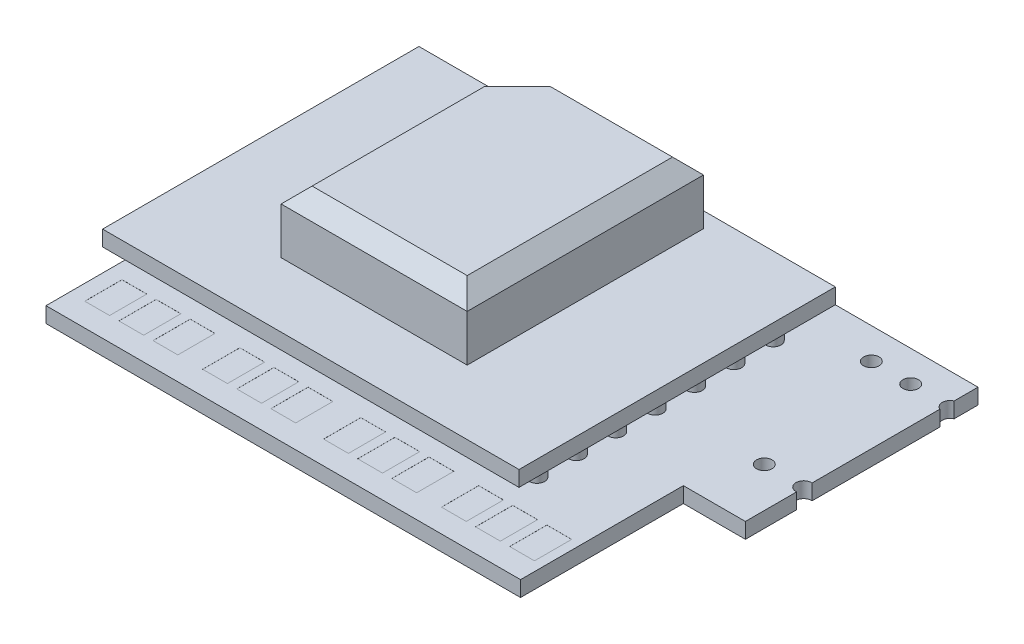
from build123d import *

# Parameters (mm, degrees)
BOSS_EXTRUDE1_DEPTH = 1
SKETCH2_R           = 0.5
CUT_EXTRUDE1_DEPTH  = 1
SKETCH3_W           = 1.6
SKETCH3_H           = 2.4
CUT_EXTRUDE2_DEPTH  = 0.005
SKETCH4_W           = 1.034148057
SKETCH4_H           = 1.598228816
CUT_EXTRUDE3_DEPTH  = 0.5
MIRROR1_START       = -10.144020373
MIRROR1_OUTLINE_W   = 1.034148057
MIRROR1_OUTLINE_H   = 0.5
MIRROR1_DEPTH       = 1.598228816
MIRROR1_START_2     = -5.06025641
MIRROR1_2_OUTLINE_W = 1.6
MIRROR1_2_OUTLINE_H = 0.005
MIRROR1_2_DEPTH     = 2.4
SKETCH5_W           = 1.034148057
SKETCH5_H           = 1
BOSS_EXTRUDE2_DEPTH = 5
SKETCH6_W           = 1.6
SKETCH6_H           = 2.4
CUT_EXTRUDE9_DEPTH  = 2
SKETCH7_W           = 1.6
SKETCH7_H           = 2.4
BOSS_EXTRUDE3_DEPTH = 0.9
SKETCH8_W           = 1.639105769
SKETCH8_H           = 2.261242675
CUT_EXTRUDE10_DEPTH = 0.5
MIRROR2_START       = 0.905
MIRROR2_OUTLINE_W   = 1.6
MIRROR2_OUTLINE_H   = 2.4
MIRROR2_DEPTH       = 0.09
SKETCH9_W           = 1.6
SKETCH9_H           = 2.4
CUT_EXTRUDE11_DEPTH = 0.1
SKETCH11_W          = 1.639105769
SKETCH11_H          = 2.261242675
BOSS_EXTRUDE4_DEPTH = 0.5
SKETCH12_R          = 0.5
BOSS_EXTRUDE5_DEPTH = 3
SKETCH13_W          = 24
SKETCH13_H          = 17.24
BOSS_EXTRUDE6_DEPTH = 1
SKETCH14_W          = 12
SKETCH14_H          = 15.24
BOSS_EXTRUDE7_DEPTH = 4
CUT_EXTRUDE12_DEPTH = 4
CHAMFER1_SIZE       = 1
BOSS_EXTRUDE8_DEPTH = 1
CUT_EXTRUDE13_DEPTH = 10


# Read off the part's stored shape, not the designer's step: Mirror1, Mirror2
with BuildPart() as part:
    # Sketch1 → Boss-Extrude1 (new body)
    with BuildSketch(Plane(origin=(0, 0, 0), x_dir=(1, 0, 0), z_dir=(0, 1, 0))):
        Polygon((-37.923076923, 26.66025641), (13.076923077, 26.66025641), (13.076923077, 11.66025641), (2.876923077, 11.66025641), (2.876923077, 1.16025641), (-27.723076923, 1.16025641), (-27.723076923, 11.66025641), (-37.923076923, 11.66025641), align=None)
    extrude(amount=BOSS_EXTRUDE1_DEPTH)

    # Sketch2 → Cut-Extrude1 (cut)
    with BuildSketch(Plane(origin=(0, 1, 0), x_dir=(1, 0, 0), z_dir=(0, 1, 0))):
        with Locations(Location((-33.923076923, 22.16025641, 0), (0, 0, 270))):
            Circle(SKETCH2_R)
        with Locations(Location((-33.923076923, 19.62025641, 0), (0, 0, 270))):
            Circle(SKETCH2_R)
        with Locations(Location((9.826923077, 22.41025641, 0), (0, 0, 270))):
            Circle(SKETCH2_R)
        with Locations(Location((9.826923077, 19.87025641, 0), (0, 0, 270))):
            Circle(SKETCH2_R)
        with Locations(Location((-35.123076923, 15.06025641, 0), (0, 0, 270))):
            Circle(SKETCH2_R)
        with Locations(Location((-32.583076923, 15.06025641, 0), (0, 0, 270))):
            Circle(SKETCH2_R)
        with Locations(Location((-30.043076923, 15.06025641, 0), (0, 0, 270))):
            Circle(SKETCH2_R)
        with Locations(Location((9.376923077, 15.46025641, 0), (0, 0, 270))):
            Circle(SKETCH2_R)
        with Locations(Location((6.836923077, 15.46025641, 0), (0, 0, 270))):
            Circle(SKETCH2_R)
        with Locations(Location((4.296923077, 15.46025641, 0), (0, 0, 270))):
            Circle(SKETCH2_R)
        with Locations(Location((7.076923077, 24.66025641, 0), (0, 0, 270))):
            Circle(SKETCH2_R)
        with Locations(Location((4.536923077, 24.66025641, 0), (0, 0, 270))):
            Circle(SKETCH2_R)
        with Locations(Location((1.996923077, 24.66025641, 0), (0, 0, 270))):
            Circle(SKETCH2_R)
    extrude(amount=-CUT_EXTRUDE1_DEPTH, mode=Mode.SUBTRACT)

    # Sketch3 → Cut-Extrude2 (cut)
    with BuildSketch(Plane(origin=(0, 1, 0), x_dir=(1, 0, 0), z_dir=(0, 1, 0))):
        with Locations((-25.923076923, 3.86025641)):
            Rectangle(SKETCH3_W, SKETCH3_H)
        with Locations((-23.723076923, 3.86025641)):
            Rectangle(SKETCH3_W, SKETCH3_H)
        with Locations((-21.523076923, 3.86025641)):
            Rectangle(SKETCH3_W, SKETCH3_H)
        with Locations((-18.323076923, 3.86025641)):
            Rectangle(SKETCH3_W, SKETCH3_H)
        with Locations((-16.123076923, 3.86025641)):
            Rectangle(SKETCH3_W, SKETCH3_H)
        with Locations((-13.923076923, 3.86025641)):
            Rectangle(SKETCH3_W, SKETCH3_H)
        with Locations((-10.523076923, 3.86025641)):
            Rectangle(SKETCH3_W, SKETCH3_H)
        with Locations((-8.323076923, 3.86025641)):
            Rectangle(SKETCH3_W, SKETCH3_H)
        with Locations((-6.123076923, 3.86025641)):
            Rectangle(SKETCH3_W, SKETCH3_H)
        with Locations((-2.923076923, 3.86025641)):
            Rectangle(SKETCH3_W, SKETCH3_H)
        with Locations((-0.723076923, 3.86025641)):
            Rectangle(SKETCH3_W, SKETCH3_H)
        with Locations((1.476923077, 3.86025641)):
            Rectangle(SKETCH3_W, SKETCH3_H)
    extrude(amount=-CUT_EXTRUDE2_DEPTH, mode=Mode.SUBTRACT)

    # Sketch4 → Cut-Extrude3 (cut)
    with BuildSketch(Plane(origin=(0, 1, 0), x_dir=(1, 0, 0), z_dir=(0, 1, 0))):
        with Locations((-12.189708408, 9.344905965)):
            Rectangle(SKETCH4_W, SKETCH4_H)
    extrude(amount=-CUT_EXTRUDE3_DEPTH, mode=Mode.SUBTRACT)

    # Mirror1 outline → Mirror1 (cut)
    with BuildSketch(Plane.XY.offset(MIRROR1_START)):
        with Locations((-12.189708408, 0.25)):
            Rectangle(MIRROR1_OUTLINE_W, MIRROR1_OUTLINE_H)
    extrude(amount=MIRROR1_DEPTH, mode=Mode.SUBTRACT)

    # Mirror1 2 outline → Mirror1 2 (cut)
    with BuildSketch(Plane.XY.offset(MIRROR1_START_2)):
        with Locations((1.476923077, 0.0025)):
            Rectangle(MIRROR1_2_OUTLINE_W, MIRROR1_2_OUTLINE_H)
        with Locations((-0.723076923, 0.0025)):
            Rectangle(MIRROR1_2_OUTLINE_W, MIRROR1_2_OUTLINE_H)
        with Locations((-2.923076923, 0.0025)):
            Rectangle(MIRROR1_2_OUTLINE_W, MIRROR1_2_OUTLINE_H)
        with Locations((-6.123076923, 0.0025)):
            Rectangle(MIRROR1_2_OUTLINE_W, MIRROR1_2_OUTLINE_H)
        with Locations((-8.323076923, 0.0025)):
            Rectangle(MIRROR1_2_OUTLINE_W, MIRROR1_2_OUTLINE_H)
        with Locations((-10.523076923, 0.0025)):
            Rectangle(MIRROR1_2_OUTLINE_W, MIRROR1_2_OUTLINE_H)
        with Locations((-13.923076923, 0.0025)):
            Rectangle(MIRROR1_2_OUTLINE_W, MIRROR1_2_OUTLINE_H)
        with Locations((-16.123076923, 0.0025)):
            Rectangle(MIRROR1_2_OUTLINE_W, MIRROR1_2_OUTLINE_H)
        with Locations((-18.323076923, 0.0025)):
            Rectangle(MIRROR1_2_OUTLINE_W, MIRROR1_2_OUTLINE_H)
        with Locations((-21.523076923, 0.0025)):
            Rectangle(MIRROR1_2_OUTLINE_W, MIRROR1_2_OUTLINE_H)
        with Locations((-23.723076923, 0.0025)):
            Rectangle(MIRROR1_2_OUTLINE_W, MIRROR1_2_OUTLINE_H)
        with Locations((-25.923076923, 0.0025)):
            Rectangle(MIRROR1_2_OUTLINE_W, MIRROR1_2_OUTLINE_H)
    extrude(amount=MIRROR1_2_DEPTH, mode=Mode.SUBTRACT)

    # Sketch5 → Boss-Extrude2 (add)
    with BuildSketch(Plane.XY.offset(-10.144020373)):
        with Locations((-12.189708408, 0.5)):
            Rectangle(SKETCH5_W, SKETCH5_H)
    extrude(amount=BOSS_EXTRUDE2_DEPTH)

    # Sketch6 → Cut-Extrude9 (cut)
    with BuildSketch(Plane(origin=(0, 0.005, 0), x_dir=(-1, 0, 0), z_dir=(0, -1, 0))):
        with Locations((17.523076923, 24.677244948)):
            Rectangle(SKETCH6_W, SKETCH6_H)
        with Locations((15.323076923, 24.677244948)):
            Rectangle(SKETCH6_W, SKETCH6_H)
        with Locations((13.123076923, 24.677244948)):
            Rectangle(SKETCH6_W, SKETCH6_H)
        with Locations((10.923076923, 24.677244948)):
            Rectangle(SKETCH6_W, SKETCH6_H)
        with Locations((8.723076923, 24.677244948)):
            Rectangle(SKETCH6_W, SKETCH6_H)
        with Locations((6.523076923, 24.677244948)):
            Rectangle(SKETCH6_W, SKETCH6_H)
        with Locations((17.523076923, 18.037244948)):
            Rectangle(SKETCH6_W, SKETCH6_H)
        with Locations((15.323076923, 18.037244948)):
            Rectangle(SKETCH6_W, SKETCH6_H)
        with Locations((13.123076923, 18.037244948)):
            Rectangle(SKETCH6_W, SKETCH6_H)
        with Locations((10.923076923, 18.037244948)):
            Rectangle(SKETCH6_W, SKETCH6_H)
        with Locations((8.723076923, 18.037244948)):
            Rectangle(SKETCH6_W, SKETCH6_H)
        with Locations((6.523076923, 18.037244948)):
            Rectangle(SKETCH6_W, SKETCH6_H)
        with Locations((18.163076923, 12.637244948)):
            Rectangle(SKETCH6_W, SKETCH6_H)
        with Locations((15.963076923, 12.637244948)):
            Rectangle(SKETCH6_W, SKETCH6_H)
        with Locations((13.763076923, 12.637244948)):
            Rectangle(SKETCH6_W, SKETCH6_H)
        with Locations((11.563076923, 12.637244948)):
            Rectangle(SKETCH6_W, SKETCH6_H)
        with Locations((9.363076923, 12.637244948)):
            Rectangle(SKETCH6_W, SKETCH6_H)
        with Locations((7.163076923, 12.637244948)):
            Rectangle(SKETCH6_W, SKETCH6_H)
    extrude(amount=-CUT_EXTRUDE9_DEPTH, mode=Mode.SUBTRACT)

    # Sketch7 → Boss-Extrude3 (add)
    with BuildSketch(Plane(origin=(0, 0.005, 0), x_dir=(1, 0, 0), z_dir=(0, 1, 0))):
        with Locations((-17.523076923, 24.677244948)):
            Rectangle(SKETCH7_W, SKETCH7_H)
        with Locations((-15.323076923, 24.677244948)):
            Rectangle(SKETCH7_W, SKETCH7_H)
        with Locations((-13.123076923, 24.677244948)):
            Rectangle(SKETCH7_W, SKETCH7_H)
        with Locations((-10.923076923, 24.677244948)):
            Rectangle(SKETCH7_W, SKETCH7_H)
        with Locations((-8.723076923, 24.677244948)):
            Rectangle(SKETCH7_W, SKETCH7_H)
        with Locations((-6.523076923, 24.677244948)):
            Rectangle(SKETCH7_W, SKETCH7_H)
        with Locations((-6.523076923, 18.037244948)):
            Rectangle(SKETCH7_W, SKETCH7_H)
        with Locations((-8.723076923, 18.037244948)):
            Rectangle(SKETCH7_W, SKETCH7_H)
        with Locations((-10.923076923, 18.037244948)):
            Rectangle(SKETCH7_W, SKETCH7_H)
        with Locations((-13.123076923, 18.037244948)):
            Rectangle(SKETCH7_W, SKETCH7_H)
        with Locations((-15.323076923, 18.037244948)):
            Rectangle(SKETCH7_W, SKETCH7_H)
        with Locations((-17.523076923, 18.037244948)):
            Rectangle(SKETCH7_W, SKETCH7_H)
        with Locations((-18.163076923, 12.637244948)):
            Rectangle(SKETCH7_W, SKETCH7_H)
        with Locations((-15.963076923, 12.637244948)):
            Rectangle(SKETCH7_W, SKETCH7_H)
        with Locations((-13.763076923, 12.637244948)):
            Rectangle(SKETCH7_W, SKETCH7_H)
        with Locations((-11.563076923, 12.637244948)):
            Rectangle(SKETCH7_W, SKETCH7_H)
        with Locations((-9.363076923, 12.637244948)):
            Rectangle(SKETCH7_W, SKETCH7_H)
        with Locations((-7.163076923, 12.637244948)):
            Rectangle(SKETCH7_W, SKETCH7_H)
    extrude(amount=BOSS_EXTRUDE3_DEPTH)

    # Sketch8 → Cut-Extrude10 (cut)
    with BuildSketch(Plane(origin=(0, 1, 0), x_dir=(1, 0, 0), z_dir=(0, 1, 0))):
        with Locations((-2.492109783, 9.627846715)):
            Rectangle(SKETCH8_W, SKETCH8_H)
    extrude(amount=-CUT_EXTRUDE10_DEPTH, mode=Mode.SUBTRACT)

    # Mirror2 outline → Mirror2 (add)
    with BuildSketch(Plane(origin=(0, 0, 0), x_dir=(1, 0, 0), z_dir=(0, 1, 0)).offset(MIRROR2_START)):
        with Locations((-7.163076923, 12.637244948)):
            Rectangle(MIRROR2_OUTLINE_W, MIRROR2_OUTLINE_H)
        with Locations((-11.563076923, 12.637244948)):
            Rectangle(MIRROR2_OUTLINE_W, MIRROR2_OUTLINE_H)
        with Locations((-15.963076923, 12.637244948)):
            Rectangle(MIRROR2_OUTLINE_W, MIRROR2_OUTLINE_H)
        with Locations((-18.163076923, 12.637244948)):
            Rectangle(MIRROR2_OUTLINE_W, MIRROR2_OUTLINE_H)
        with Locations((-13.763076923, 12.637244948)):
            Rectangle(MIRROR2_OUTLINE_W, MIRROR2_OUTLINE_H)
        with Locations((-9.363076923, 12.637244948)):
            Rectangle(MIRROR2_OUTLINE_W, MIRROR2_OUTLINE_H)
        with Locations((-15.323076923, 18.037244948)):
            Rectangle(MIRROR2_OUTLINE_W, MIRROR2_OUTLINE_H)
        with Locations((-15.323076923, 24.677244948)):
            Rectangle(MIRROR2_OUTLINE_W, MIRROR2_OUTLINE_H)
        with Locations((-10.923076923, 18.037244948)):
            Rectangle(MIRROR2_OUTLINE_W, MIRROR2_OUTLINE_H)
        with Locations((-6.523076923, 18.037244948)):
            Rectangle(MIRROR2_OUTLINE_W, MIRROR2_OUTLINE_H)
        with Locations((-17.523076923, 18.037244948)):
            Rectangle(MIRROR2_OUTLINE_W, MIRROR2_OUTLINE_H)
        with Locations((-13.123076923, 18.037244948)):
            Rectangle(MIRROR2_OUTLINE_W, MIRROR2_OUTLINE_H)
        with Locations((-8.723076923, 18.037244948)):
            Rectangle(MIRROR2_OUTLINE_W, MIRROR2_OUTLINE_H)
        with Locations((-10.923076923, 24.677244948)):
            Rectangle(MIRROR2_OUTLINE_W, MIRROR2_OUTLINE_H)
        with Locations((-6.523076923, 24.677244948)):
            Rectangle(MIRROR2_OUTLINE_W, MIRROR2_OUTLINE_H)
        with Locations((-8.723076923, 24.677244948)):
            Rectangle(MIRROR2_OUTLINE_W, MIRROR2_OUTLINE_H)
        with Locations((-13.123076923, 24.677244948)):
            Rectangle(MIRROR2_OUTLINE_W, MIRROR2_OUTLINE_H)
        with Locations((-17.523076923, 24.677244948)):
            Rectangle(MIRROR2_OUTLINE_W, MIRROR2_OUTLINE_H)
    extrude(amount=MIRROR2_DEPTH)

    # Sketch9 → Cut-Extrude11 (cut)
    with BuildSketch(Plane(origin=(0, 0, 0), x_dir=(-1, 0, 0), z_dir=(0, -1, 0))):
        with Locations((16.923076923, 12.36025641)):
            Rectangle(SKETCH9_W, SKETCH9_H)
        with Locations((14.723076923, 12.36025641)):
            Rectangle(SKETCH9_W, SKETCH9_H)
        with Locations((12.523076923, 12.36025641)):
            Rectangle(SKETCH9_W, SKETCH9_H)
        with Locations((10.323076923, 12.36025641)):
            Rectangle(SKETCH9_W, SKETCH9_H)
        with Locations((8.123076923, 12.36025641)):
            Rectangle(SKETCH9_W, SKETCH9_H)
        with Locations((5.923076923, 12.36025641)):
            Rectangle(SKETCH9_W, SKETCH9_H)
    extrude(amount=-CUT_EXTRUDE11_DEPTH, mode=Mode.SUBTRACT)

    # Sketch11 → Boss-Extrude4 (add)
    with BuildSketch(Plane(origin=(0, 0.5, 0), x_dir=(1, 0, 0), z_dir=(0, 1, 0))):
        with Locations((-2.492109783, 9.627846715)):
            Rectangle(SKETCH11_W, SKETCH11_H)
    extrude(amount=BOSS_EXTRUDE4_DEPTH)

    # Sketch12 → Boss-Extrude5 (add)
    with BuildSketch(Plane(origin=(0, 1, 0), x_dir=(1, 0, 0), z_dir=(0, 1, 0))):
        with Locations(Location((-2.323076923, 22.66025641, 0), (0, 0, 90))):
            Circle(SKETCH12_R)
        with Locations(Location((-2.323076923, 20.12025641, 0), (0, 0, 90))):
            Circle(SKETCH12_R)
        with Locations(Location((-2.323076923, 17.58025641, 0), (0, 0, 90))):
            Circle(SKETCH12_R)
        with Locations(Location((-2.323076923, 15.04025641, 0), (0, 0, 90))):
            Circle(SKETCH12_R)
        with Locations(Location((-2.323076923, 12.50025641, 0), (0, 0, 90))):
            Circle(SKETCH12_R)
        with Locations(Location((-2.323076923, 9.96025641, 0), (0, 0, 90))):
            Circle(SKETCH12_R)
        with Locations(Location((-2.323076923, 7.42025641, 0), (0, 0, 90))):
            Circle(SKETCH12_R)
        with Locations(Location((-23.323076923, 7.42025641, 0), (0, 0, 90))):
            Circle(SKETCH12_R)
        with Locations(Location((-23.323076923, 9.96025641, 0), (0, 0, 90))):
            Circle(SKETCH12_R)
        with Locations(Location((-23.323076923, 12.50025641, 0), (0, 0, 90))):
            Circle(SKETCH12_R)
        with Locations(Location((-23.323076923, 15.04025641, 0), (0, 0, 90))):
            Circle(SKETCH12_R)
        with Locations(Location((-23.323076923, 17.58025641, 0), (0, 0, 90))):
            Circle(SKETCH12_R)
        with Locations(Location((-23.323076923, 20.12025641, 0), (0, 0, 90))):
            Circle(SKETCH12_R)
        with Locations(Location((-23.323076923, 22.66025641, 0), (0, 0, 90))):
            Circle(SKETCH12_R)
    extrude(amount=BOSS_EXTRUDE5_DEPTH)

    # Sketch13 → Boss-Extrude6 (add)
    with BuildSketch(Plane(origin=(0, 4, 0), x_dir=(1, 0, 0), z_dir=(0, 1, 0))):
        with Locations((-12.823076923, 15.04025641)):
            Rectangle(SKETCH13_W, SKETCH13_H)
    extrude(amount=BOSS_EXTRUDE6_DEPTH)

    # Sketch14 → Boss-Extrude7 (add)
    with BuildSketch(Plane(origin=(0, 5, 0), x_dir=(1, 0, 0), z_dir=(0, 1, 0))):
        with Locations((-12.823076923, 15.04025641)):
            Rectangle(SKETCH14_W, SKETCH14_H)
    extrude(amount=BOSS_EXTRUDE7_DEPTH)

    # Sketch15 → Cut-Extrude12 (cut)
    with BuildSketch(Plane(origin=(0, 9, 0), x_dir=(1, 0, 0), z_dir=(0, 1, 0))):
        Polygon((-18.823076923, 19.962332908), (-16.12515342, 22.66025641), (-18.823076923, 22.66025641), align=None)
    extrude(amount=-CUT_EXTRUDE12_DEPTH, mode=Mode.SUBTRACT)

    # Chamfer1
    chamfer1_edges = [part.edges().sort_by_distance(p)[0] for p in [
        (-12.823076923, 9, -7.42025641),
        (-6.823076923, 9, -15.04025641),
        (-11.474115172, 9, -22.66025641),
        (-18.823076923, 9, -13.691294659),
        (-17.474115172, 9, -21.311294659),
    ]]
    chamfer(chamfer1_edges, length=CHAMFER1_SIZE)

    # Sketch16 → Boss-Extrude8 (add)
    with BuildSketch(Plane(origin=(0, 5, 0), x_dir=(1, 0, 0), z_dir=(0, 1, 0))):
        Polygon((-24.823076923, 23.66025641), (0.676923077, 23.66025641), (0.676923077, 3.26228509), (-24.823076923, 3.26228509), (-26.175069403, 3.26228509), (-26.175069403, 23.66025641), align=None)
    extrude(amount=-BOSS_EXTRUDE8_DEPTH)

    # Sketch17 → Cut-Extrude13 (cut)
    with BuildSketch(Plane(origin=(0, 1, 0), x_dir=(1, 0, 0), z_dir=(0, 1, 0))):
        Polygon((-29.923076923, 28.116879978), (6.876923077, 28.116879978), (6.876923077, 9.542014815), (19.111418826, 9.542014815), (19.741075272, 33.547666827), (-48.025699752, 28.982657592), (-43.460690517, 9.06977248), (-29.923076923, 11.66025641), align=None)
    extrude(amount=-CUT_EXTRUDE13_DEPTH, mode=Mode.SUBTRACT)


solid = part.part
